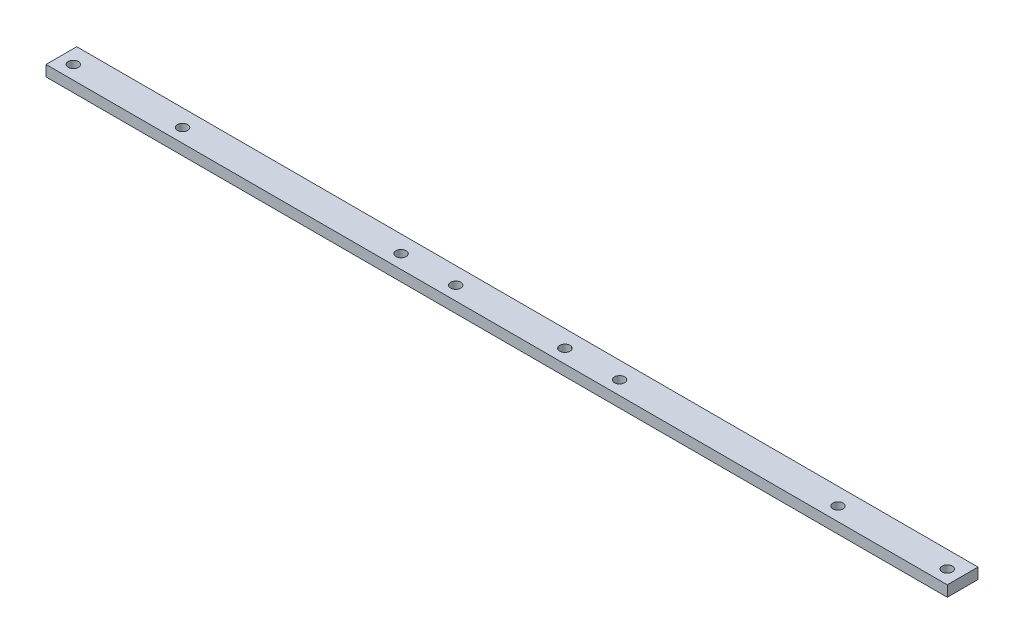
from build123d import *

# Parameters (mm, degrees)
SKETCH1_R           = 2
SKETCH1_R_2         = 1.5
BOSS_EXTRUDE1_DEPTH = 3.175
SKETCH2_R           = 1.5
CUT_EXTRUDE1_DEPTH  = 10
SKETCH3_W           = 264
SKETCH3_H           = 15
CUT_EXTRUDE2_DEPTH  = 10
SKETCH4_W           = 264
SKETCH4_H           = 3.5
CUT_EXTRUDE3_DEPTH  = 11.5
SKETCH5_W           = 264
SKETCH5_H           = 1
CUT_EXTRUDE4_DEPTH  = 10


with BuildPart() as part:
    # Sketch1 → Boss-Extrude1 (new body)
    with BuildSketch(Plane(origin=(0, 0, 0), x_dir=(1, 0, 0), z_dir=(0, 1, 0))):
        Polygon((0, 25.535634143), (0, -1.464365857), (264, -1.464365857), (264, 3.535634143), (264, 25.535634143), align=None)
        with Locations((132, 21.535634143)):
            Circle(SKETCH1_R, mode=Mode.SUBTRACT)
        with Locations((100, 21.535634143)):
            Circle(SKETCH1_R, mode=Mode.SUBTRACT)
        with Locations((68, 21.535634143)):
            Circle(SKETCH1_R, mode=Mode.SUBTRACT)
        with Locations((196, 21.535634143)):
            Circle(SKETCH1_R, mode=Mode.SUBTRACT)
        with Locations((164, 21.535634143)):
            Circle(SKETCH1_R, mode=Mode.SUBTRACT)
        with Locations((260, 3.535634143)):
            Circle(SKETCH1_R_2, mode=Mode.SUBTRACT)
        with Locations((36, 3.535634143)):
            Circle(SKETCH1_R_2, mode=Mode.SUBTRACT)
        with Locations((228, 3.535634143)):
            Circle(SKETCH1_R_2, mode=Mode.SUBTRACT)
        with Locations((4, 3.535634143)):
            Circle(SKETCH1_R_2, mode=Mode.SUBTRACT)
    extrude(amount=BOSS_EXTRUDE1_DEPTH)

    # Sketch2 → Cut-Extrude1 (cut)
    with BuildSketch(Plane(origin=(0, 3.175, 0), x_dir=(1, 0, 0), z_dir=(0, 1, 0))):
        with Locations((116, 3.535634143)):
            Circle(SKETCH2_R)
        with Locations((148, 3.535634143)):
            Circle(SKETCH2_R)
        with Locations((100, 3.535634143)):
            Circle(SKETCH2_R)
        with Locations((164, 3.535634143)):
            Circle(SKETCH2_R)
    extrude(amount=-CUT_EXTRUDE1_DEPTH, mode=Mode.SUBTRACT)

    # Sketch3 → Cut-Extrude2 (cut)
    with BuildSketch(Plane(origin=(0, 3.175, 0), x_dir=(1, 0, 0), z_dir=(0, 1, 0))):
        with Locations((132, 18.035634143)):
            Rectangle(SKETCH3_W, SKETCH3_H)
    extrude(amount=-CUT_EXTRUDE2_DEPTH, mode=Mode.SUBTRACT)

    # Sketch4 → Cut-Extrude3 (cut)
    with BuildSketch(Plane(origin=(0, 3.175, 0), x_dir=(1, 0, 0), z_dir=(0, 1, 0))):
        with Locations((132, 10.285634143)):
            Rectangle(SKETCH4_W, SKETCH4_H)
    extrude(amount=-CUT_EXTRUDE3_DEPTH, mode=Mode.SUBTRACT)

    # Sketch5 → Cut-Extrude4 (cut)
    with BuildSketch(Plane(origin=(0, 3.175, 0), x_dir=(1, 0, 0), z_dir=(0, 1, 0))):
        with Locations((132, -0.964365857)):
            Rectangle(SKETCH5_W, SKETCH5_H)
    extrude(amount=-CUT_EXTRUDE4_DEPTH, mode=Mode.SUBTRACT)


solid = part.part
